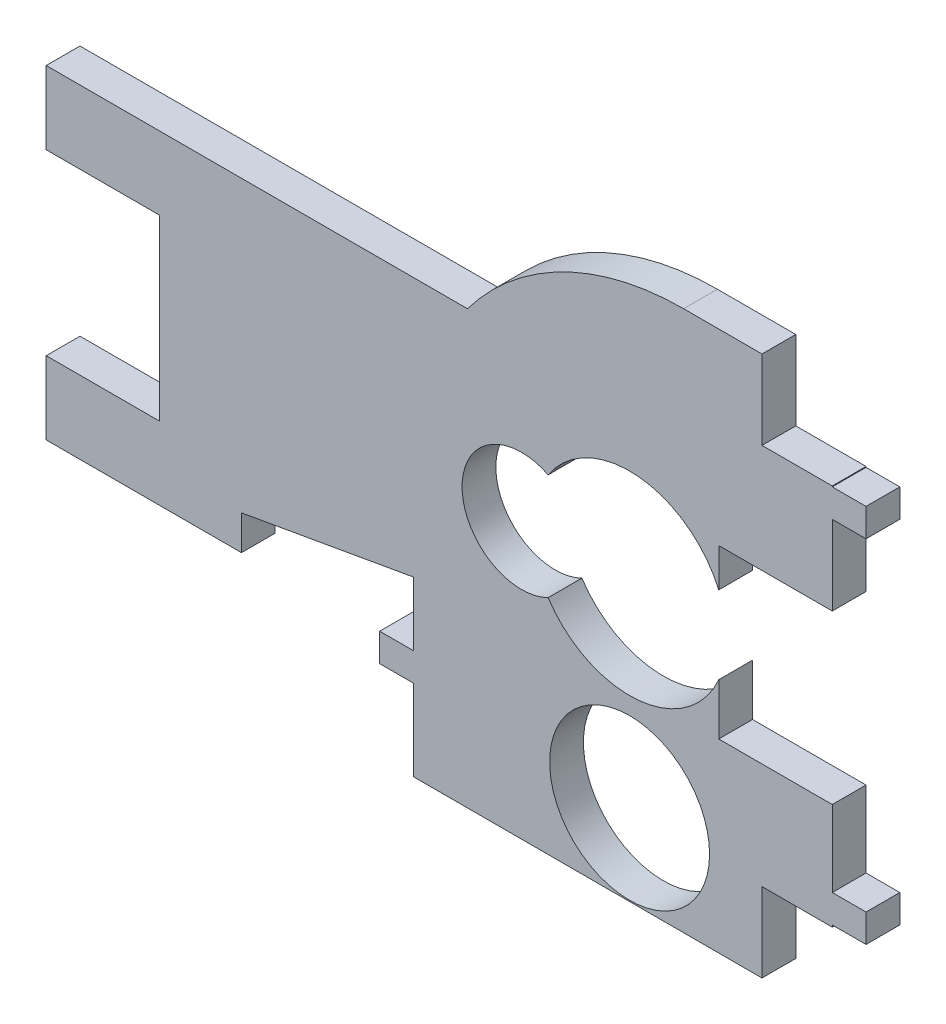
from build123d import *

# Parameters (mm, degrees)
SKETCH1_R           = 3.7592
BOSS_EXTRUDE1_DEPTH = 1.5875
CUT_EXTRUDE1_REACH  = 36.935
SKETCH2_W           = 3.302
SKETCH2_H           = 3.7211


with BuildPart() as part:
    # Sketch1 → Boss-Extrude1 (new body)
    with BuildSketch(Plane.XY):
        with BuildLine():
            Line((11.1125, 17.8308), (9.525, 17.8308))
            Line((9.525, 17.8308), (9.525, 21.59))
            Line((9.525, 21.59), (2.54, 21.59))
            ThreePointArc((2.54, 21.59), (-3.139612663, 20.249225326), (-7.62, 16.51))
            Line((-7.62, 16.51), (-27.418921519, 16.51))
            Line((-27.418921519, 16.51), (-27.418921519, 13.081))
            Line((-27.418921519, 13.081), (-22.084921519, 13.081))
            Line((-22.084921519, 13.081), (-22.084921519, 4.699))
            Line((-22.084921519, 4.699), (-27.418921519, 4.699))
            Line((-27.418921519, 4.699), (-27.418921519, 1.27))
            Line((-27.418921519, 1.27), (-18.241771939, 1.27))
            Line((-18.241771939, 1.27), (-18.241771939, 2.890724209))
            Line((-18.241771939, 2.890724209), (-10.16, 4.318))
            Line((-10.16, 4.318), (-10.16, 1.3208))
            Line((-10.16, 1.3208), (-11.7475, 1.3208))
            Line((-11.7475, 1.3208), (-11.7475, 0))
            Line((-11.7475, 0), (-10.16, 0))
            Line((-10.16, 0), (-10.16, -3.81))
            Line((-10.16, -3.81), (9.525, -3.81))
            Line((9.525, -3.81), (9.525, 0))
            Line((9.525, 0), (11.1125, 0))
            Line((11.1125, 0), (11.1125, 1.3208))
            Line((11.1125, 1.3208), (9.525, 1.3208))
            Line((9.525, 1.3208), (9.525, 4.9022))
            Line((9.525, 4.9022), (4.191, 4.9022))
            Line((4.191, 4.9022), (4.191, 7.31678819))
            ThreePointArc((4.191, 7.31678819), (0.381242222, 4.587922919), (-3.82905, 6.645688551))
            ThreePointArc((-3.82905, 6.645688551), (-7.874, 9.144), (-3.82905, 11.642311449))
            ThreePointArc((-3.82905, 11.642311449), (0.381242222, 13.700077081), (4.191, 10.97121181))
            Line((4.191, 10.97121181), (4.191, 12.7762))
            Line((4.191, 12.7762), (9.525, 12.7762))
            Line((9.525, 12.7762), (9.525, 16.51))
            Line((9.525, 16.51), (11.1125, 16.51))
            Line((11.1125, 16.51), (11.1125, 17.8308))
        make_face()
        Circle(SKETCH1_R, mode=Mode.SUBTRACT)
    extrude(amount=BOSS_EXTRUDE1_DEPTH)

    # Sketch2 → Cut-Extrude1 (cut, up to next)
    with BuildSketch(Plane.XY.offset(1.5875), mode=Mode.PRIVATE) as cut_extrude1_sk1:
        with Locations((7.874, -1.94945)):
            Rectangle(SKETCH2_W, SKETCH2_H)
    cut_extrude1_tool1 = extrude(cut_extrude1_sk1.sketch, amount=-CUT_EXTRUDE1_REACH, mode=Mode.PRIVATE) & part.part
    # Sketch2 → Cut-Extrude1 (cut, up to next)
    with BuildSketch(Plane.XY.offset(1.5875), mode=Mode.PRIVATE) as cut_extrude1_sk2:
        with Locations((7.874, 19.72945)):
            Rectangle(SKETCH2_W, SKETCH2_H)
    cut_extrude1_tool2 = extrude(cut_extrude1_sk2.sketch, amount=-CUT_EXTRUDE1_REACH, mode=Mode.PRIVATE) & part.part
    add(cut_extrude1_tool1.solids().sort_by_distance((7.874, -1.94945, 1.5875))[0], mode=Mode.SUBTRACT)
    add(cut_extrude1_tool2.solids().sort_by_distance((7.874, 19.72945, 1.5875))[0], mode=Mode.SUBTRACT)


solid = part.part
